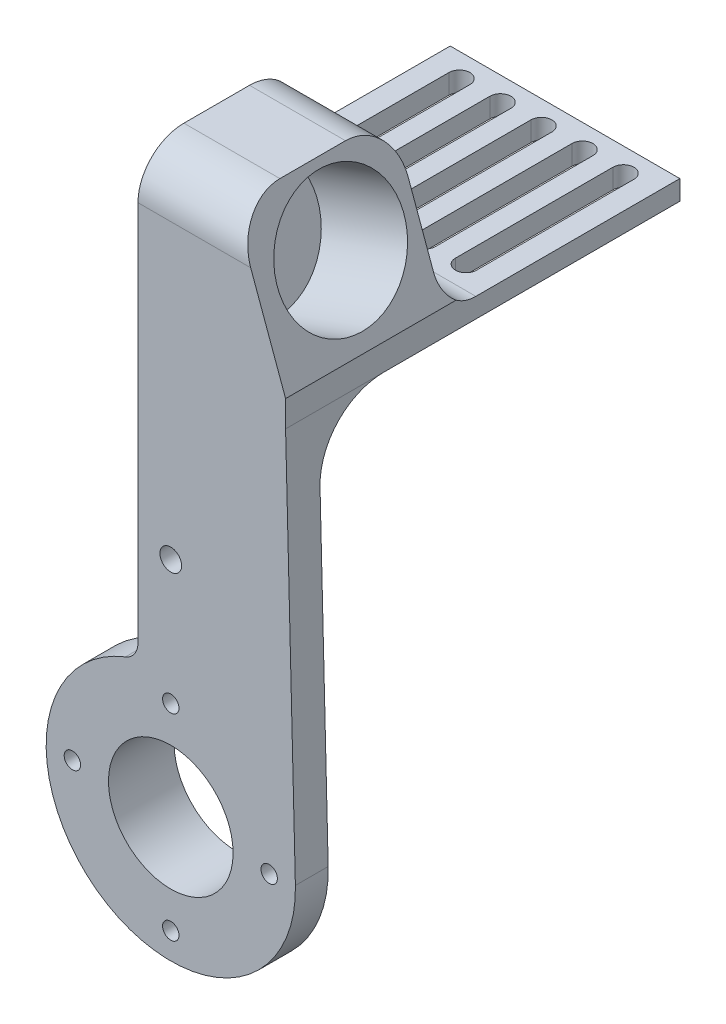
from build123d import *
from build123d.topology import SkipClean

# Parameters (mm, degrees)
SKETCH2_R                 = 9.5
BOSS_EXTRUDE1_DEPTH       = 5
SKETCH3_W                 = 35
SKETCH3_H                 = 85.128
BOSS_EXTRUDE2_DEPTH       = 3
BOSS_EXTRUDE3_START       = 5
SKETCH4_R                 = 13
SKETCH4_R_2               = 9.5
BOSS_EXTRUDE3_DEPTH       = 5
SKETCH5_W                 = 35
SKETCH5_H                 = 9
BOSS_EXTRUDE4_DEPTH       = 3
M3X0_5_TAPPED_HOLE1_D     = 2.5
M3X0_5_TAPPED_HOLE1_DEPTH = 3
BOSS_EXTRUDE5_DEPTH       = 24
SKETCH11_R                = 9.652
CUT_EXTRUDE1_DEPTH        = 14
CUT_EXTRUDE2_START        = -5
CUT_EXTRUDE2_DEPTH        = 5
CUT_EXTRUDE4_DEPTH        = 3
SKETCH15_W                = 35
SKETCH15_H                = 25.028
CUT_EXTRUDE5_DEPTH        = 12
M3X0_5_TAPPED_HOLE2_D     = 2.5
M3X0_5_TAPPED_HOLE2_DEPTH = 6.5
M3X0_5_TAPPED_HOLE2_TIP   = 0.751075774
FILLET7_R                 = 7
BOSS_EXTRUDE6_START       = -5
BOSS_EXTRUDE6_DEPTH       = 5
FILLET3_R                 = 5
CUT_EXTRUDE6_START        = -25
CUT_EXTRUDE6_DEPTH        = 25
FILLET5_R                 = 10
FILLET4_R                 = 3
M4X0_7_TAPPED_HOLE1_D     = 3.3


with BuildPart() as part:
    # Sketch2 → Boss-Extrude1 (new body)
    with BuildSketch(Plane.XY):
        with BuildLine():
            Line((-18.994017858, 0.476744791), (-17.5, 60))
            Line((-17.5, 60), (17.5, 60))
            Line((17.5, 60), (18.994017858, 0.476744791))
            ThreePointArc((18.994017858, 0.476744791), (0, -19), (-18.994017858, 0.476744791))
        make_face()
        Circle(SKETCH2_R, mode=Mode.SUBTRACT)
    extrude(amount=BOSS_EXTRUDE1_DEPTH)

    # Sketch3 → Boss-Extrude2 (add)
    with BuildSketch(Plane(origin=(0, 60, 0), x_dir=(1, 0, 0), z_dir=(0, 1, 0))):
        with Locations((0, 37.564)):
            Rectangle(SKETCH3_W, SKETCH3_H)
    extrude(amount=BOSS_EXTRUDE2_DEPTH)

    # Sketch4 → Boss-Extrude3 (add)
    with SkipClean():  # the faces are left unmerged after this step: merging them gives an invalid solid
        with BuildSketch(Plane(origin=(0, 0, 0), x_dir=(-1, 0, 0), z_dir=(0, 0, -1)).offset(BOSS_EXTRUDE3_START)):
            with Locations(Location((0, 0, 0), (0, 0, 180))):
                Circle(SKETCH4_R)
            Circle(SKETCH4_R_2, mode=Mode.SUBTRACT)
        extrude(amount=-BOSS_EXTRUDE3_DEPTH)

    # Sketch5 → Boss-Extrude4 (add)
    with SkipClean():  # the faces are left unmerged after this step: merging them gives an invalid solid
        with BuildSketch(Plane(origin=(0, 0, -80.128), x_dir=(-1, 0, 0), z_dir=(0, 0, -1))):
            with Locations((0, 55.5)):
                Rectangle(SKETCH5_W, SKETCH5_H)
        extrude(amount=-BOSS_EXTRUDE4_DEPTH)

    # M3x0.5 Tapped Hole1
    with Locations(Plane(origin=(0, 0, -80.128), x_dir=(1, 0, 0), z_dir=(0, 0, -1))):
        with Locations((12, -55.5), (0, -55.5), (-12, -55.5)):
            Hole(M3X0_5_TAPPED_HOLE1_D / 2, depth=M3X0_5_TAPPED_HOLE1_DEPTH)

    # Sketch10 → Boss-Extrude5 (add)
    with SkipClean():  # the faces are left unmerged after this step: merging them gives an invalid solid
        with BuildSketch(Plane.XY.offset(5)):
            Polygon((-5, 85.612930278), (-5, 63), (17.5, 63), (17.5, 64), (9.633536704, 85.612930278), align=None)
        extrude(amount=-BOSS_EXTRUDE5_DEPTH)

    # Sketch11 → Cut-Extrude1 (cut)
    with SkipClean():  # the faces are left unmerged after this step: merging them gives an invalid solid
        with BuildSketch(Plane(origin=(-1.821352029, 117.084978414, 0), x_dir=(0, 0, -1), z_dir=(-0.9396926207859069, -0.34202014332567293, 0))):
            with Locations(Location((7.5, 44.49185408, 0), (0, 0, 90))):
                Circle(SKETCH11_R)
        extrude(amount=CUT_EXTRUDE1_DEPTH, mode=Mode.SUBTRACT)

    # Sketch12 → Cut-Extrude2 (cut)
    with SkipClean():  # the faces are left unmerged after this step: merging them gives an invalid solid
        with BuildSketch(Plane.XY.offset(5).offset(CUT_EXTRUDE2_START)):
            with BuildLine():
                Line((-13.548939673, 58), (13.548939673, 58))
                Line((13.548939673, 58), (14.702658736, 12.034609511))
                ThreePointArc((14.702658736, 12.034609511), (0, 19), (-14.702658736, 12.034609511))
                Line((-14.702658736, 12.034609511), (-13.548939673, 58))
            make_face()
        extrude(amount=CUT_EXTRUDE2_DEPTH, mode=Mode.SUBTRACT)

    # Sketch14 → Cut-Extrude4 (cut)
    with SkipClean():  # the faces are left unmerged after this step: merging them gives an invalid solid
        with BuildSketch(Plane(origin=(0, 63, 0), x_dir=(1, 0, 0), z_dir=(0, 1, 0))):
            with BuildLine():
                Line((-14.1, 51.5), (-14.1, 27.5))
                ThreePointArc((-14.1, 27.5), (-12.5, 25.9), (-10.9, 27.5))
                Line((-10.9, 27.5), (-10.9, 51.5))
                ThreePointArc((-10.9, 51.5), (-12.5, 53.1), (-14.1, 51.5))
            make_face()
            with BuildLine():
                Line((-1.6, 51.5), (-1.6, 27.5))
                ThreePointArc((-1.6, 27.5), (0, 25.9), (1.6, 27.5))
                Line((1.6, 27.5), (1.6, 51.5))
                ThreePointArc((1.6, 51.5), (0, 53.1), (-1.6, 51.5))
            make_face()
            with BuildLine():
                Line((10.9, 51.5), (10.9, 27.5))
                ThreePointArc((10.9, 27.5), (12.5, 25.9), (14.1, 27.5))
                Line((14.1, 27.5), (14.1, 51.5))
                ThreePointArc((14.1, 51.5), (12.5, 53.1), (10.9, 51.5))
            make_face()
            with BuildLine():
                Line((-7.85, 51.5), (-7.85, 27.5))
                ThreePointArc((-7.85, 27.5), (-6.25, 25.9), (-4.65, 27.5))
                Line((-4.65, 27.5), (-4.65, 51.5))
                ThreePointArc((-4.65, 51.5), (-6.25, 53.1), (-7.85, 51.5))
            make_face()
            with BuildLine():
                Line((4.65, 51.5), (4.65, 27.5))
                ThreePointArc((4.65, 27.5), (6.25, 25.9), (7.85, 27.5))
                Line((7.85, 27.5), (7.85, 51.5))
                ThreePointArc((7.85, 51.5), (6.25, 53.1), (4.65, 51.5))
            make_face()
        extrude(amount=-CUT_EXTRUDE4_DEPTH, mode=Mode.SUBTRACT)

    # Sketch15 → Cut-Extrude5 (cut)
    with SkipClean():  # the faces are left unmerged after this step: merging them gives an invalid solid
        with BuildSketch(Plane(origin=(0, 63, 0), x_dir=(1, 0, 0), z_dir=(0, 1, 0))):
            with Locations((0, 67.614)):
                Rectangle(SKETCH15_W, SKETCH15_H)
        extrude(amount=-CUT_EXTRUDE5_DEPTH, mode=Mode.SUBTRACT)

    # M3x0.5 Tapped Hole2
    with Locations(Plane.XY.offset(5)):
        with Locations((0, 15), (15, 0), (0, -15), (-15, 0)):
            Hole(M3X0_5_TAPPED_HOLE2_D / 2, depth=M3X0_5_TAPPED_HOLE2_DEPTH)
            with Locations((0, 0, -(M3X0_5_TAPPED_HOLE2_DEPTH + M3X0_5_TAPPED_HOLE2_TIP / 2))):  # 118° drill point
                Cone(0, M3X0_5_TAPPED_HOLE2_D / 2, M3X0_5_TAPPED_HOLE2_TIP, mode=Mode.SUBTRACT)

    # Fillet7
    fillet7_edges = [part.edges().sort_by_distance(p)[0] for p in [
        (2.316768352, 85.612930278, 5),
        (2.316768352, 85.612930278, -19),
    ]]
    fillet(fillet7_edges, radius=FILLET7_R)

    # Sketch22 → Boss-Extrude6 (add)
    with SkipClean():  # the faces are left unmerged after this step: merging them gives an invalid solid
        with BuildSketch(Plane.XY.offset(5).offset(BOSS_EXTRUDE6_START)):
            with BuildLine():
                Line((-5, 58), (-5, 18.33030278))
                ThreePointArc((-5, 18.33030278), (5.783107735, 18.098498969), (14.702658736, 12.034609511))
                Line((14.702658736, 12.034609511), (13.548939673, 58))
                Line((13.548939673, 58), (-5, 58))
            make_face()
        extrude(amount=BOSS_EXTRUDE6_DEPTH)

    # Fillet3
    # the kernel refuses this fillet: 5 mm, written as the material it adds along each edge
    with BuildSketch(Plane(origin=(-5, 63, -19), x_dir=(0, 1, 0), z_dir=(1, 0, 0))) as fillet3_piece_1_section:
        with BuildLine():
            CenterArc((FILLET3_R, -FILLET3_R), FILLET3_R, 90, 90)
            Line((0, -FILLET3_R), (0, 0))
            Line((0, 0), (FILLET3_R, 0))
        make_face()
    fillet3_piece_1 = extrude(amount=22.5, mode=Mode.PRIVATE)
    fillet3_piece_1 = split(fillet3_piece_1, bisect_by=Plane(origin=(16.135828419, 67.748030616, -20.138902613), z_dir=(-0.9396926207859069, -0.34202014332567293, 0)), keep=Keep.TOP, mode=Mode.PRIVATE)
    add(fillet3_piece_1)

    # Sketch25 → Cut-Extrude6 (cut)
    with SkipClean():  # the faces are left unmerged after this step: merging them gives an invalid solid
        with BuildSketch(Plane.XY.offset(5).offset(CUT_EXTRUDE6_START)):
            with BuildLine():
                Line((-5, 63), (-17.5, 63))
                Line((-17.5, 63), (-18.994017858, 0.476744791))
                ThreePointArc((-18.994017858, 0.476744791), (-14.953782346, 11.721108887), (-5, 18.33030278))
                Line((-5, 18.33030278), (-5, 63))
            make_face()
        extrude(amount=CUT_EXTRUDE6_DEPTH, mode=Mode.SUBTRACT)

    # Fillet5
    # the kernel refuses this fillet: 10 mm, written as the material it adds along each edge
    with BuildSketch(Plane(origin=(-5, 60, 0), x_dir=(0, 0, -1), z_dir=(1, 0, 0))) as fillet5_piece_1:
        with BuildLine():
            CenterArc((FILLET5_R, -FILLET5_R), FILLET5_R, 90, 90)
            Line((0, -FILLET5_R), (0, 0))
            Line((0, 0), (FILLET5_R, 0))
        make_face()
    extrude(amount=22.5)
    with BuildSketch(Plane(origin=(-5, 60, 0), x_dir=(0, 0, -1), z_dir=(1, 0, 0))) as fillet5_piece_2_section:
        with BuildLine():
            CenterArc((FILLET5_R, -FILLET5_R), FILLET5_R, 90, 90)
            Line((0, -FILLET5_R), (0, 0))
            Line((0, 0), (FILLET5_R, 0))
        make_face()
    fillet5_piece_2 = extrude(amount=47.5, mode=Mode.PRIVATE)
    fillet5_piece_2 = split(fillet5_piece_2, bisect_by=Plane(origin=(17.5, 55.698819483, -1.064725127), z_dir=(1, 0, 0)), keep=Keep.TOP, mode=Mode.PRIVATE)
    fillet5_piece_2 = split(fillet5_piece_2, bisect_by=Plane(origin=(17.607924501, 55.700173495, -1.064725127), z_dir=(-0.9996851504403609, -0.0250918311215615, 0)), keep=Keep.TOP, mode=Mode.PRIVATE)
    add(fillet5_piece_2)

    # Fillet4
    fillet4_edges = [part.edges().sort_by_distance(p)[0] for p in [
        (-5, 18.33030278, 2.5),
        (-17.5, 61.5, -20),
        (-5, 61.5, -20),
    ]]
    fillet(fillet4_edges, radius=FILLET4_R)

    # M4x0.7 Tapped Hole1 (through all)
    with Locations(Plane.XY.offset(5)):
        with Locations((0, 34)):
            Hole(M4X0_7_TAPPED_HOLE1_D / 2)


solid = part.part
